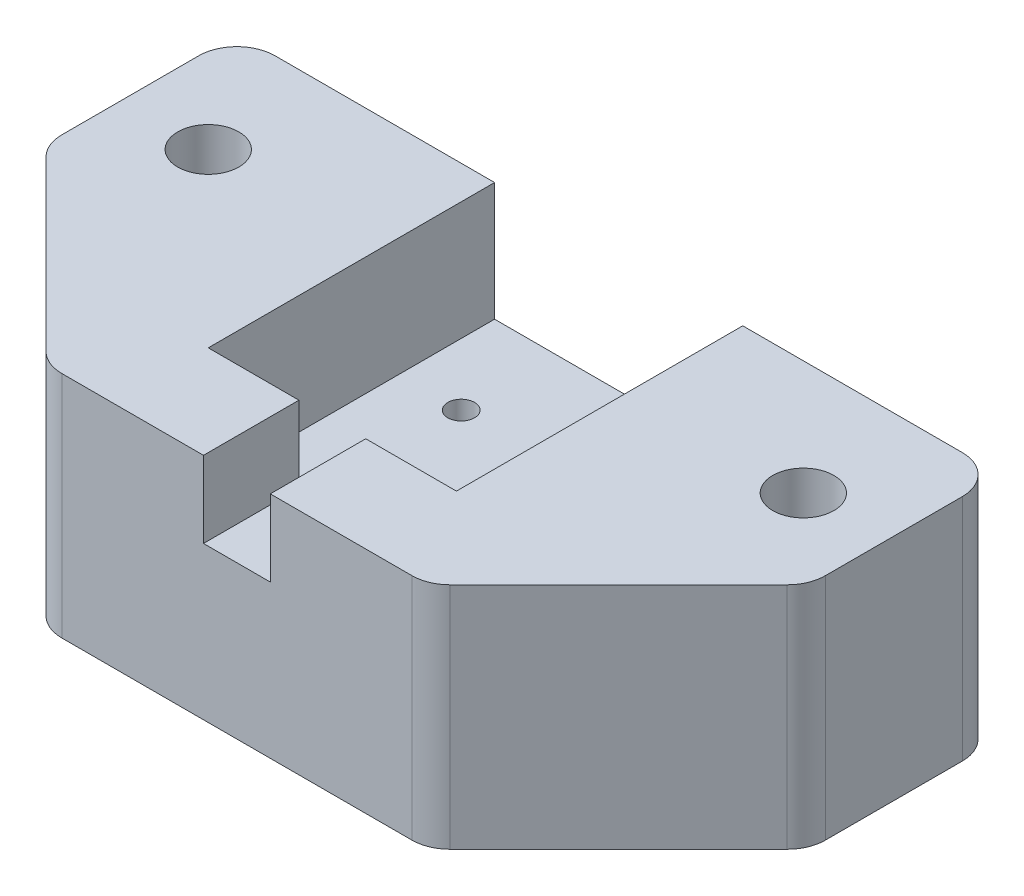
from build123d import *

# Parameters (mm, degrees)
SKETCH_1_W          = 40
SKETCH_1_H          = 20
SKETCH_1_R          = 1.6
EXTRUDE_1_DEPTH     = 12
SKETCH_2_W          = 13
SKETCH_2_H          = 15
CUT_EXTRUDE_1_DEPTH = 6.2
SKETCH_3_W          = 3.5
SKETCH_3_H          = 5
CUT_EXTRUDE_2_DEPTH = 4
CHAMFER_1_SIZE      = 10
FILLET_1_R          = 2
SKETCH_4_R          = 0.7
CUT_EXTRUDE_3_DEPTH = 46.149086369
SKETCH_5_R          = 3
CUT_EXTRUDE_4_DEPTH = 4
CHAMFER_2_SIZE      = 2


with BuildPart() as part:
    # 草图1 → 凸台-拉伸1 (new body)
    with BuildSketch(Plane(origin=(0, 0, 0), x_dir=(1, 0, 0), z_dir=(0, 1, 0))):
        with Locations((20, -10)):
            Rectangle(SKETCH_1_W, SKETCH_1_H)
        with Locations(Location((4.5, -6, 0), (0, 0, 270))):
            Circle(SKETCH_1_R, mode=Mode.SUBTRACT)
        with Locations(Location((35.672897196, -6, 0), (0, 0, 270))):
            Circle(SKETCH_1_R, mode=Mode.SUBTRACT)
    extrude(amount=EXTRUDE_1_DEPTH)

    # 草图2 → 切除-拉伸1 (cut)
    with BuildSketch(Plane(origin=(0, 12, 0), x_dir=(1, 0, 0), z_dir=(0, 1, 0))):
        with Locations((20, -7.5)):
            Rectangle(SKETCH_2_W, SKETCH_2_H)
    extrude(amount=-CUT_EXTRUDE_1_DEPTH, mode=Mode.SUBTRACT)

    # 草图3 → 切除-拉伸2 (cut)
    with BuildSketch(Plane(origin=(0, 12, 0), x_dir=(1, 0, 0), z_dir=(0, 1, 0))):
        with Locations((20, -17.5)):
            Rectangle(SKETCH_3_W, SKETCH_3_H)
    extrude(amount=-CUT_EXTRUDE_2_DEPTH, mode=Mode.SUBTRACT)

    # 倒角1
    chamfer_1_edges = [part.edges().sort_by_distance(p)[0] for p in [
        (40, 6, 20),
        (0, 6, 20),
    ]]
    chamfer(chamfer_1_edges, length=CHAMFER_1_SIZE)

    # 圆角1
    fillet_1_edges = [part.edges().sort_by_distance(p)[0] for p in [
        (40, 6, 10),
        (10, 6, 20),
        (30, 6, 20),
        (0, 6, 10),
        (0, 6, 0),
        (40, 6, 0),
    ]]
    fillet(fillet_1_edges, radius=FILLET_1_R)

    # 草图4 → 切除-拉伸3 (cut, through all)
    with BuildSketch(Plane(origin=(0, 5.8, 0), x_dir=(1, 0, 0), z_dir=(0, 1, 0))):
        with Locations(Location((16.75, -5, 0), (0, 0, 270))):
            Circle(SKETCH_4_R)
        with Locations(Location((23.25, -5, 0), (0, 0, 270))):
            Circle(SKETCH_4_R)
    extrude(amount=-CUT_EXTRUDE_3_DEPTH, mode=Mode.SUBTRACT)

    # 草图5 → 切除-拉伸4 (cut)
    with BuildSketch(Plane(origin=(0, 0, 0), x_dir=(-1, 0, 0), z_dir=(0, -1, 0))):
        with Locations(Location((-35.672897196, -6, 0), (0, 0, 90))):
            Circle(SKETCH_5_R)
        with Locations(Location((-4.5, -6, 0), (0, 0, 90))):
            Circle(SKETCH_5_R)
    extrude(amount=-CUT_EXTRUDE_4_DEPTH, mode=Mode.SUBTRACT)

    # 倒角2
    # the kernel refuses this chamfer: 2 mm, written as the material it takes off along each edge
    with BuildSketch(Plane(origin=(35.672897196, 4, 6), x_dir=(0, 0, 1), z_dir=(1, 0, 0))) as chamfer_2_piece_1_section:
        Polygon((1.6 + CHAMFER_2_SIZE, 0), (1.6, -CHAMFER_2_SIZE), (1.6, 0), align=None)
    chamfer_2_piece_1 = revolve(axis=Axis((35.672897196, 4, 6), (0, -1, 0)), mode=Mode.PRIVATE)
    chamfer_2_piece_1 = chamfer_2_piece_1 & Plane(origin=(35.672897196, 5.307163584, 6), x_dir=(0, 0, -1), z_dir=(0, -1, 0)) * Cylinder(3, 15, mode=Mode.PRIVATE)
    add(chamfer_2_piece_1, mode=Mode.SUBTRACT)
    with BuildSketch(Plane(origin=(4.5, 4, 6), x_dir=(0, 0, 1), z_dir=(1, 0, 0))) as chamfer_2_piece_2_section:
        Polygon((1.6 + CHAMFER_2_SIZE, 0), (1.6, -CHAMFER_2_SIZE), (1.6, 0), align=None)
    chamfer_2_piece_2 = revolve(axis=Axis((4.5, 4, 6), (0, -1, 0)), mode=Mode.PRIVATE)
    chamfer_2_piece_2 = chamfer_2_piece_2 & Plane(origin=(4.5, 5.307163584, 6), x_dir=(0, 0, -1), z_dir=(0, -1, 0)) * Cylinder(3, 15, mode=Mode.PRIVATE)
    add(chamfer_2_piece_2, mode=Mode.SUBTRACT)


solid = part.part
